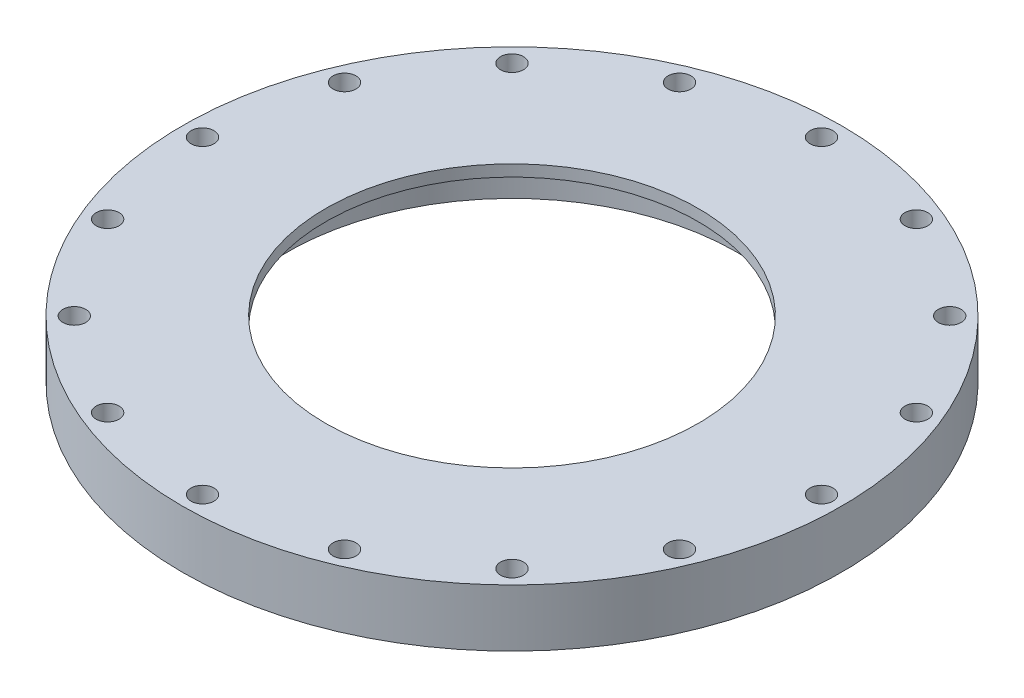
from build123d import *

# Parameters (mm, degrees)
SKETCH1_R           = 57.5
SKETCH1_R_2         = 39.25
BOSS_EXTRUDE1_DEPTH = 8
SKETCH3_R           = 57.5
SKETCH3_R_2         = 32.5
BOSS_EXTRUDE2_DEPTH = 2
SKETCH2_R           = 2
CUT_EXTRUDE1_DEPTH  = 25


with BuildPart() as part:
    # Sketch1 → Boss-Extrude1 (new body)
    with BuildSketch(Plane(origin=(0, 0, 0), x_dir=(1, 0, 0), z_dir=(0, 1, 0))):
        Circle(SKETCH1_R)
        Circle(SKETCH1_R_2, mode=Mode.SUBTRACT)
    extrude(amount=BOSS_EXTRUDE1_DEPTH)

    # Sketch3 → Boss-Extrude2 (add)
    with BuildSketch(Plane(origin=(0, 8, 0), x_dir=(1, 0, 0), z_dir=(0, 1, 0))):
        Circle(SKETCH3_R)
        Circle(SKETCH3_R_2, mode=Mode.SUBTRACT)
    extrude(amount=BOSS_EXTRUDE2_DEPTH)

    # Sketch2 → Cut-Extrude1 (cut)
    with BuildSketch(Plane(origin=(0, 10, 0), x_dir=(1, 0, 0), z_dir=(0, 1, 0))):
        with Locations((0, 54)):
            Circle(SKETCH2_R)
        with Locations((20.664905348, 49.889494756)):
            Circle(SKETCH2_R)
        with Locations((38.183766184, 38.183766184)):
            Circle(SKETCH2_R)
        with Locations((49.889494756, 20.664905348)):
            Circle(SKETCH2_R)
        with Locations((54, 0)):
            Circle(SKETCH2_R)
        with Locations((49.889494756, -20.664905348)):
            Circle(SKETCH2_R)
        with Locations((38.183766184, -38.183766184)):
            Circle(SKETCH2_R)
        with Locations((20.664905348, -49.889494756)):
            Circle(SKETCH2_R)
        with Locations((0, -54)):
            Circle(SKETCH2_R)
        with Locations((-20.664905348, -49.889494756)):
            Circle(SKETCH2_R)
        with Locations((-38.183766184, -38.183766184)):
            Circle(SKETCH2_R)
        with Locations((-49.889494756, -20.664905348)):
            Circle(SKETCH2_R)
        with Locations((-54, 0)):
            Circle(SKETCH2_R)
        with Locations((-49.889494756, 20.664905348)):
            Circle(SKETCH2_R)
        with Locations((-38.183766184, 38.183766184)):
            Circle(SKETCH2_R)
        with Locations((-20.664905348, 49.889494756)):
            Circle(SKETCH2_R)
    extrude(amount=-CUT_EXTRUDE1_DEPTH, mode=Mode.SUBTRACT)


solid = part.part
